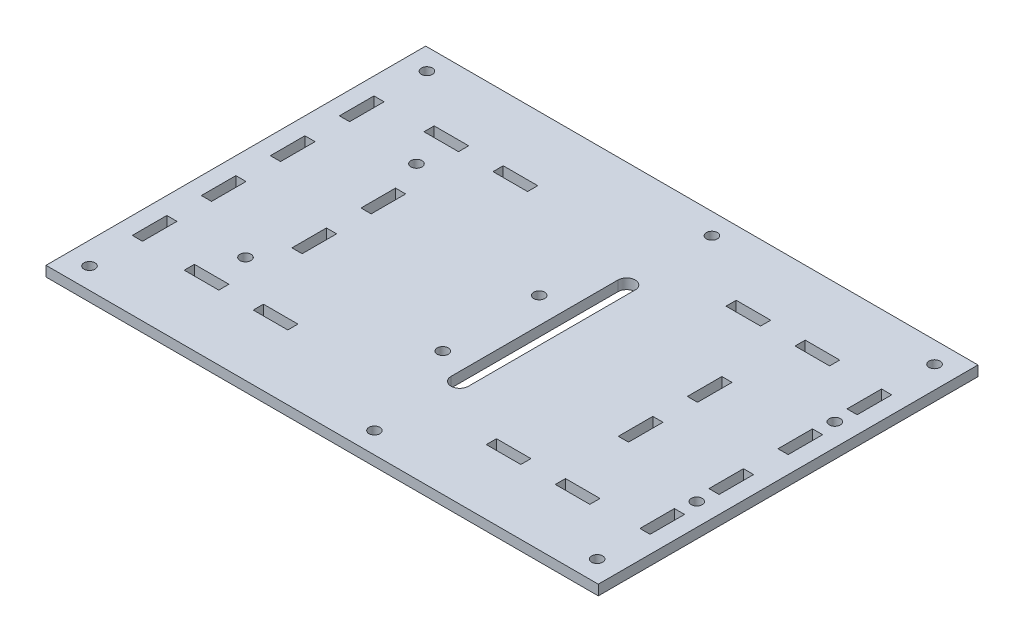
from build123d import *

# Parameters (mm, degrees)
BOTTOM_PLATE_OUTLINE_W   = 160
BOTTOM_PLATE_OUTLINE_H   = 110
BOTTOM_PLATE_OUTLINE_R   = 1.6
BOTTOM_PLATE_OUTLINE_W_2 = 2.95
BOTTOM_PLATE_OUTLINE_H_2 = 10
BOTTOM_PLATE_OUTLINE_W_3 = 10
BOTTOM_PLATE_OUTLINE_H_3 = 2.95
BOTTOM_PLATE_DEPTH       = 2.95
M3_CLEARANCE_HOLE1_D     = 3.2
SKETCH6_W                = 5
SKETCH6_H                = 53.34
CUT_EXTRUDE1_DEPTH       = 98.127249009
FILLET1_R                = 2.5
FILLET2_R                = 2.5
M3_CLEARANCE_HOLE2_D     = 3.2
M3_CLEARANCE_HOLE3_D     = 3.2
SKETCH12_W               = 2.95
SKETCH12_H               = 10
CUT_EXTRUDE4_DEPTH       = 98.127249009


# Read off the part's stored shape, not the designer's step: Bottom Plate
with BuildPart() as part:
    # Bottom Plate outline → Bottom Plate (new body)
    with BuildSketch(Plane(origin=(0, 0, 0), x_dir=(1, 0, 0), z_dir=(0, 1, 0))):
        Rectangle(BOTTOM_PLATE_OUTLINE_W, BOTTOM_PLATE_OUTLINE_H)
        with Locations((-73.525, -48.875)):
            Circle(BOTTOM_PLATE_OUTLINE_R, mode=Mode.SUBTRACT)
        with Locations((-73.525, -30)):
            Rectangle(BOTTOM_PLATE_OUTLINE_W_2, BOTTOM_PLATE_OUTLINE_H_2, mode=Mode.SUBTRACT)
        with Locations((-53.75, -34.729)):
            Rectangle(BOTTOM_PLATE_OUTLINE_W_3, BOTTOM_PLATE_OUTLINE_H_3, mode=Mode.SUBTRACT)
        with Locations((-33.75, -34.729)):
            Rectangle(BOTTOM_PLATE_OUTLINE_W_3, BOTTOM_PLATE_OUTLINE_H_3, mode=Mode.SUBTRACT)
        with Locations((-73.525, -10)):
            Rectangle(BOTTOM_PLATE_OUTLINE_W_2, BOTTOM_PLATE_OUTLINE_H_2, mode=Mode.SUBTRACT)
        with Locations((33.75, -34.729)):
            Rectangle(BOTTOM_PLATE_OUTLINE_W_3, BOTTOM_PLATE_OUTLINE_H_3, mode=Mode.SUBTRACT)
        with Locations((73.525, -48.875)):
            Circle(BOTTOM_PLATE_OUTLINE_R, mode=Mode.SUBTRACT)
        with Locations((53.75, -34.729)):
            Rectangle(BOTTOM_PLATE_OUTLINE_W_3, BOTTOM_PLATE_OUTLINE_H_3, mode=Mode.SUBTRACT)
        with Locations((73.525, -30)):
            Rectangle(BOTTOM_PLATE_OUTLINE_W_2, BOTTOM_PLATE_OUTLINE_H_2, mode=Mode.SUBTRACT)
        with Locations((73.525, -10)):
            Rectangle(BOTTOM_PLATE_OUTLINE_W_2, BOTTOM_PLATE_OUTLINE_H_2, mode=Mode.SUBTRACT)
        with Locations((-73.525, 10)):
            Rectangle(BOTTOM_PLATE_OUTLINE_W_2, BOTTOM_PLATE_OUTLINE_H_2, mode=Mode.SUBTRACT)
        with Locations((-73.525, 30)):
            Rectangle(BOTTOM_PLATE_OUTLINE_W_2, BOTTOM_PLATE_OUTLINE_H_2, mode=Mode.SUBTRACT)
        with Locations((-53.75, 34.729)):
            Rectangle(BOTTOM_PLATE_OUTLINE_W_3, BOTTOM_PLATE_OUTLINE_H_3, mode=Mode.SUBTRACT)
        with Locations((-73.525, 48.875)):
            Circle(BOTTOM_PLATE_OUTLINE_R, mode=Mode.SUBTRACT)
        with Locations((-33.75, 34.729)):
            Rectangle(BOTTOM_PLATE_OUTLINE_W_3, BOTTOM_PLATE_OUTLINE_H_3, mode=Mode.SUBTRACT)
        with Locations((73.525, 10)):
            Rectangle(BOTTOM_PLATE_OUTLINE_W_2, BOTTOM_PLATE_OUTLINE_H_2, mode=Mode.SUBTRACT)
        with Locations((33.75, 34.729)):
            Rectangle(BOTTOM_PLATE_OUTLINE_W_3, BOTTOM_PLATE_OUTLINE_H_3, mode=Mode.SUBTRACT)
        with Locations((53.75, 34.729)):
            Rectangle(BOTTOM_PLATE_OUTLINE_W_3, BOTTOM_PLATE_OUTLINE_H_3, mode=Mode.SUBTRACT)
        with Locations((73.525, 30)):
            Rectangle(BOTTOM_PLATE_OUTLINE_W_2, BOTTOM_PLATE_OUTLINE_H_2, mode=Mode.SUBTRACT)
        with Locations((73.525, 48.875)):
            Circle(BOTTOM_PLATE_OUTLINE_R, mode=Mode.SUBTRACT)
    extrude(amount=BOTTOM_PLATE_DEPTH)

    # M3 Clearance Hole1 (through all)
    with Locations(Plane(origin=(0, 2.95, 0), x_dir=(1, 0, 0), z_dir=(0, 1, 0))):
        with Locations((-51.81, 24.13), (-53.08, -24.13), (-1.01, -19.05), (-1.01, 8.89)):
            Hole(M3_CLEARANCE_HOLE1_D / 2)

    # Sketch6 → Cut-Extrude1 (cut, through all)
    with BuildSketch(Plane(origin=(0, 2.95, 0), x_dir=(1, 0, 0), z_dir=(0, 1, 0))):
        with Locations((9.03, 0)):
            Rectangle(SKETCH6_W, SKETCH6_H)
    extrude(amount=-CUT_EXTRUDE1_DEPTH, mode=Mode.SUBTRACT)

    # Fillet1
    fillet1_edges = [part.edges().sort_by_distance(p)[0] for p in [
        (6.53, 1.475, -26.67),
        (11.53, 1.475, -26.67),
    ]]
    fillet(fillet1_edges, radius=FILLET1_R - 0.0001)  # a hair under: the kernel refuses the full size

    # Fillet2
    fillet2_edges = [part.edges().sort_by_distance(p)[0] for p in [
        (6.53, 1.475, 26.67),
        (11.53, 1.475, 26.67),
    ]]
    fillet(fillet2_edges, radius=FILLET2_R - 0.0001)  # a hair under: the kernel refuses the full size

    # M3 Clearance Hole2 (through all)
    with Locations(Plane(origin=(0, 2.95, 0), x_dir=(1, 0, 0), z_dir=(0, 1, 0))):
        with Locations((73.525, -20), (73.525, 20)):
            Hole(M3_CLEARANCE_HOLE2_D / 2)

    # M3 Clearance Hole3 (through all)
    with Locations(Plane(origin=(0, 2.95, 0), x_dir=(1, 0, 0), z_dir=(0, 1, 0))):
        with Locations((9.03, -48.875), (9.03, 48.875)):
            Hole(M3_CLEARANCE_HOLE3_D / 2)

    # Sketch12 → Cut-Extrude4 (cut, through all)
    with BuildSketch(Plane.XZ):
        with Locations((47.275, 10)):
            Rectangle(SKETCH12_W, SKETCH12_H)
        with Locations((47.275, -10)):
            Rectangle(SKETCH12_W, SKETCH12_H)
    cut_extrude4 = extrude(amount=-CUT_EXTRUDE4_DEPTH, mode=Mode.SUBTRACT)

    # Mirror1: Cut-Extrude4 across plane
    add(cut_extrude4.mirror(Plane(origin=(0, 0, 0), x_dir=(0, 0, 1), z_dir=(1, 0, 0))), mode=Mode.SUBTRACT)


solid = part.part
